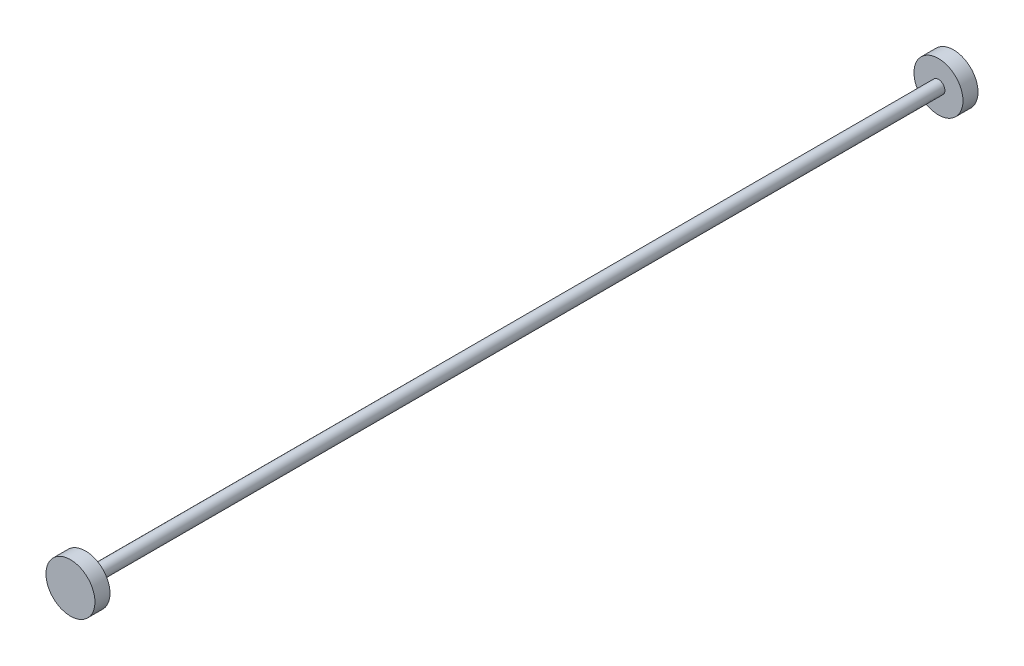
from build123d import *

# Parameters (mm, degrees)
SKETCH1_R           = 2.44
BOSS_EXTRUDE1_DEPTH = 1.5
SKETCH2_R           = 0.64
BOSS_EXTRUDE2_DEPTH = 85
LPATTERN2_COUNT     = 2
LPATTERN2_PITCH     = 86.5


with BuildPart() as part:
    # Sketch1 → Boss-Extrude1 (new body)
    with BuildSketch(Plane.XY):
        Circle(SKETCH1_R)
    boss_extrude1 = extrude(amount=BOSS_EXTRUDE1_DEPTH)

    # Sketch2 → Boss-Extrude2 (add)
    with BuildSketch(Plane.XY.offset(1.5)):
        Circle(SKETCH2_R)
    extrude(amount=BOSS_EXTRUDE2_DEPTH)

    # LPattern2: Boss-Extrude1 ×2
    with Locations(*[(0, 0, i * LPATTERN2_PITCH) for i in range(1, LPATTERN2_COUNT)]):
        add(boss_extrude1)


solid = part.part
